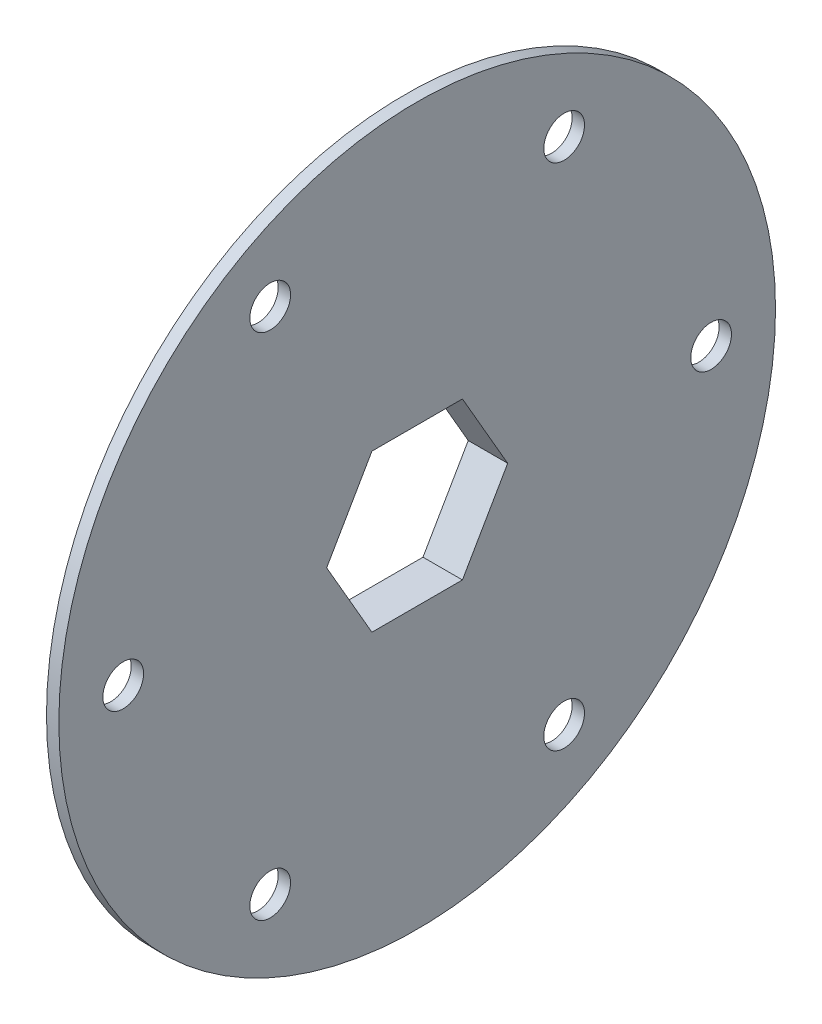
from build123d import *

# Parameters (mm, degrees)
SKETCH1_R           = 29.03
SKETCH1_R_2         = 1.65
BOSS_EXTRUDE1_DEPTH = 1
SKETCH1_3_R         = 9
BOSS_EXTRUDE2_DEPTH = 2.195433
FILLET1_R           = 5


with BuildPart() as part:
    # Sketch1 → Boss-Extrude1 (new body)
    with BuildSketch(Plane(origin=(0, 0, 0), x_dir=(0, 0, -1), z_dir=(1, 0, 0))):
        Circle(SKETCH1_R)
        with Locations((11.90625, -20.622229928)):
            Circle(SKETCH1_R_2, mode=Mode.SUBTRACT)
        with Locations((23.8125, 0)):
            Circle(SKETCH1_R_2, mode=Mode.SUBTRACT)
        with Locations((11.90625, 20.622229928)):
            Circle(SKETCH1_R_2, mode=Mode.SUBTRACT)
        with Locations((-11.90625, 20.622229928)):
            Circle(SKETCH1_R_2, mode=Mode.SUBTRACT)
        with Locations((-23.8125, 0)):
            Circle(SKETCH1_R_2, mode=Mode.SUBTRACT)
        with Locations((-11.90625, -20.622229928)):
            Circle(SKETCH1_R_2, mode=Mode.SUBTRACT)
        Polygon((3.666174209, 6.35), (-3.666174209, 6.35), (-7.332348419, 0), (-3.666174209, -6.35), (3.666174209, -6.35), (7.332348419, 0), align=None, mode=Mode.SUBTRACT)
    extrude(amount=BOSS_EXTRUDE1_DEPTH)

    # Sketch1<3> → Boss-Extrude2 (add)
    with BuildSketch(Plane(origin=(0, 0, 0), x_dir=(0, 0, -1), z_dir=(1, 0, 0))):
        Circle(SKETCH1_3_R)
        Polygon((-3.666174209, 6.35), (3.666174209, 6.35), (7.332348419, 0), (3.666174209, -6.35), (-3.666174209, -6.35), (-7.332348419, 0), align=None, mode=Mode.SUBTRACT)
    extrude(amount=-BOSS_EXTRUDE2_DEPTH)

    # Fillet1
    # the kernel refuses this fillet: 5 mm, written as the material it adds along each edge
    with BuildSketch(Plane(origin=(0, 0, 0), x_dir=(0, 0, -1), z_dir=(0, -1, 0))) as fillet1_piece_1:
        with BuildLine():
            CenterArc((13.139372409, -5), FILLET1_R, 90, 55.881011)
            Line((13.139372409, 0), (13.139372409, 0.1))
            Line((13.139372409, 0.1), (9, 0.1))
            Line((9, 0.1), (8.9, 0))
            ThreePointArc((8.9, 0), (8.9, -1.0977165), (8.917212552, -2.13934166))
            Line((8.917212552, -2.13934166), (9, -2.195433))
        make_face()
    revolve(axis=Axis((0, 0, 0), (1, 0, 0)))


solid = part.part
